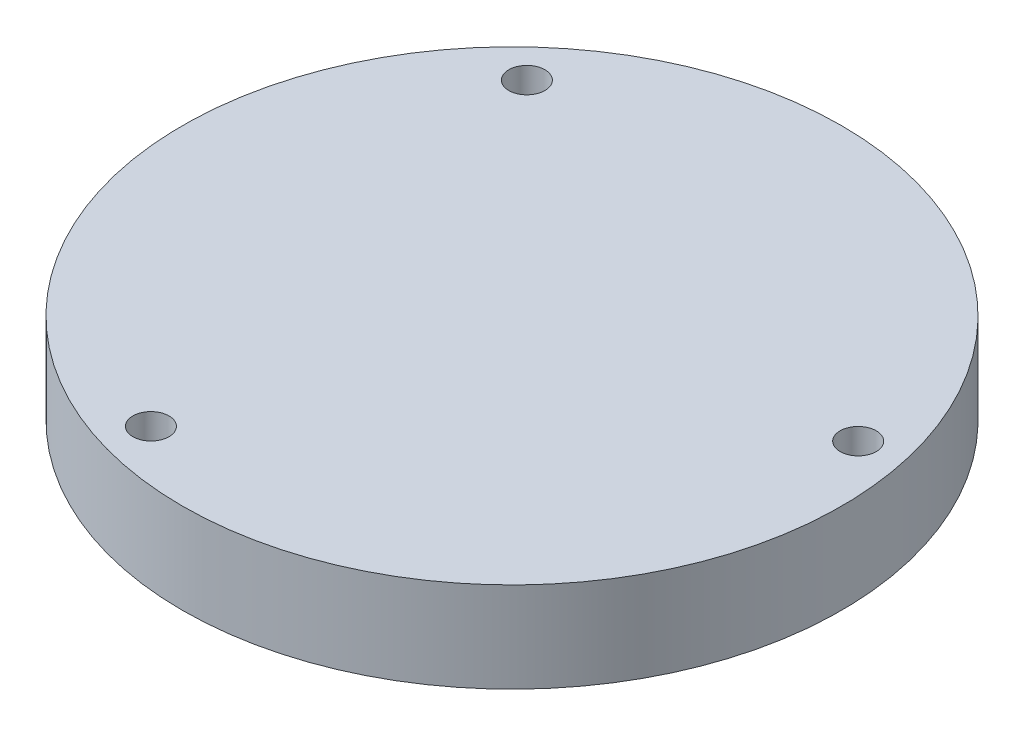
from build123d import *

# Parameters (mm, degrees)
SKETCH1_R           = 36.5
BOSS_EXTRUDE1_DEPTH = 10
SKETCH3_R           = 2
CUT_EXTRUDE1_DEPTH  = 53.578512721
CIRPATTERN1_COUNT   = 3


with BuildPart() as part:
    # Sketch1 → Boss-Extrude1 (new body)
    with BuildSketch(Plane(origin=(0, 0, 0), x_dir=(1, 0, 0), z_dir=(0, 1, 0))):
        Circle(SKETCH1_R)
    extrude(amount=BOSS_EXTRUDE1_DEPTH)

    # Sketch3 → Cut-Extrude1 (cut, through all)
    with BuildSketch(Plane(origin=(0, 10, 0), x_dir=(1, 0, 0), z_dir=(0, 1, 0))):
        with Locations((-21.788986033, 23.435871813)):
            Circle(SKETCH3_R)
    cut_extrude1 = extrude(amount=-CUT_EXTRUDE1_DEPTH, mode=Mode.SUBTRACT)

    # CirPattern1: Cut-Extrude1 ×3 about axis
    cirpattern1_axis = Axis((0, 10, 0), (0, 1, 0))
    for i in range(1, CIRPATTERN1_COUNT):
        add(cut_extrude1.rotate(cirpattern1_axis, i * 360 / CIRPATTERN1_COUNT), mode=Mode.SUBTRACT)


solid = part.part
